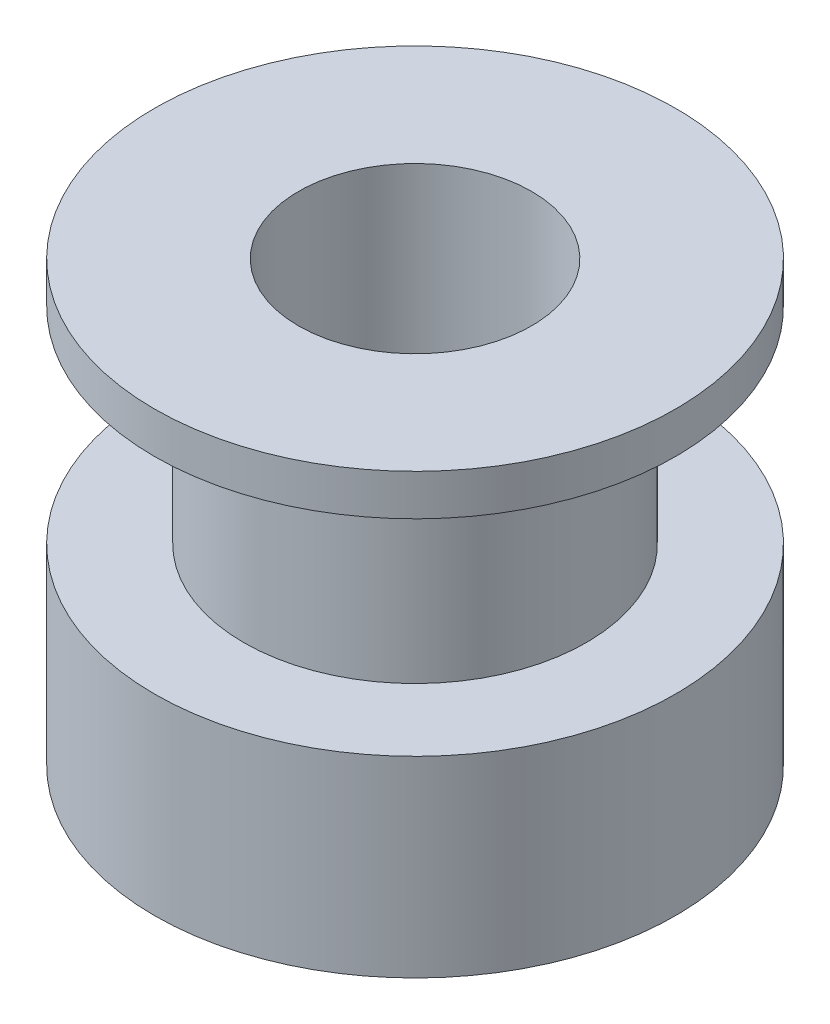
from build123d import *

# Parameters (mm, degrees)
SKETCH1_R           = 9.5
BOSS_EXTRUDE1_DEPTH = 7
SKETCH2_R           = 6.25
BOSS_EXTRUDE2_DEPTH = 7.5
SKETCH3_R           = 9.5
BOSS_EXTRUDE3_DEPTH = 1.5
SKETCH4_R           = 4.25
CUT_EXTRUDE1_DEPTH  = 21.892582416


with BuildPart() as part:
    # Sketch1 → Boss-Extrude1 (new body)
    with BuildSketch(Plane(origin=(0, 0, 0), x_dir=(1, 0, 0), z_dir=(0, 1, 0))):
        Circle(SKETCH1_R)
    extrude(amount=BOSS_EXTRUDE1_DEPTH)

    # Sketch2 → Boss-Extrude2 (add)
    with BuildSketch(Plane(origin=(0, 7, 0), x_dir=(1, 0, 0), z_dir=(0, 1, 0))):
        Circle(SKETCH2_R)
    extrude(amount=BOSS_EXTRUDE2_DEPTH)

    # Sketch3 → Boss-Extrude3 (add)
    with BuildSketch(Plane(origin=(0, 14.5, 0), x_dir=(1, 0, 0), z_dir=(0, 1, 0))):
        Circle(SKETCH3_R)
    extrude(amount=BOSS_EXTRUDE3_DEPTH)

    # Sketch4 → Cut-Extrude1 (cut, through all)
    with BuildSketch(Plane(origin=(0, 16, 0), x_dir=(1, 0, 0), z_dir=(0, 1, 0))):
        Circle(SKETCH4_R)
    extrude(amount=-CUT_EXTRUDE1_DEPTH, mode=Mode.SUBTRACT)


solid = part.part
